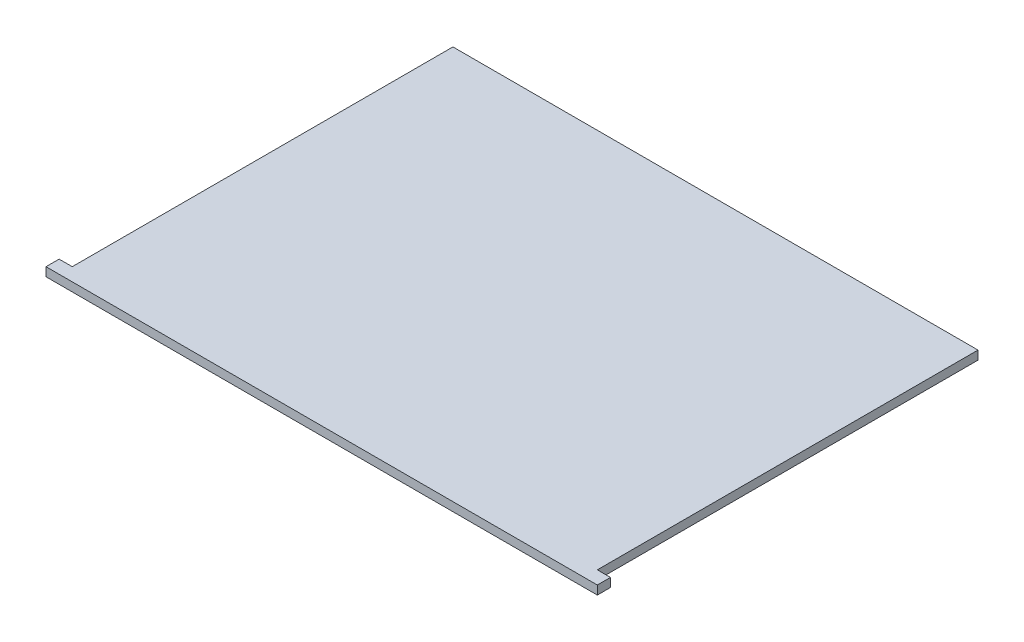
from build123d import *

# Parameters (mm, degrees)
BOSS_EXTRUDE1_DEPTH = 1


with BuildPart() as part:
    # Sketch1 → Boss-Extrude1 (new body)
    with BuildSketch(Plane(origin=(0, 0, 0), x_dir=(1, 0, 0), z_dir=(0, 1, 0))):
        Polygon((-30, -22.5), (30, -22.5), (31.5, -22.5), (31.5, -21), (30, -21), (30, 22.5), (-30, 22.5), (-30, -21), (-31.5, -21), (-31.5, -22.5), align=None)
    extrude(amount=BOSS_EXTRUDE1_DEPTH)


solid = part.part
